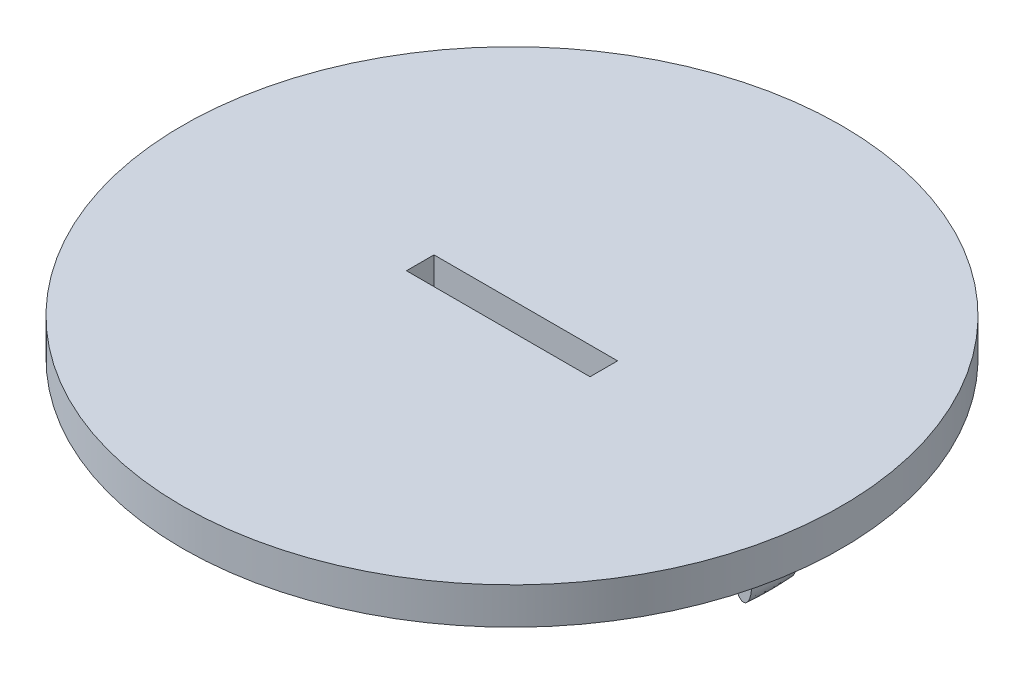
from build123d import *

# Parameters (mm, degrees)
SKETCH_1_R          = 17.95
EXTRUDE_1_DEPTH     = 2
SKETCH_3_R          = 6
EXTRUDE_3_DEPTH     = 1
SKETCH_2_W          = 10
SKETCH_2_H          = 1.5
CUT_EXTRUDE_3_DEPTH = 2
EXTRUDE_1_2_DEPTH   = 1.25
FILLET_6_SIZE       = 1
FILLET_6_SIZE_2     = 2
EXTRUDE_4_DEPTH     = 4
FILLET_3_SIZE       = 1
FILLET_3_SIZE_2     = 0.5
FILLET_4_SIZE       = 1
FILLET_4_SIZE_2     = 0.5
EXTRUDE_5_DEPTH     = 1.4
EXTRUDE_6_DEPTH     = 0.6
FILLET_5_SIZE       = 0.5
FILLET_5_SIZE_2     = 1


# Read off the part's stored shape, not the designer's step: 拉伸-薄壁1
with BuildPart() as part:
    # 草图1 → Extrude 1 (new body)
    with BuildSketch(Plane(origin=(0, 0, 0), x_dir=(1, 0, 0), z_dir=(0, 1, 0))):
        with Locations(Location((0, 0, 0), (0, 0, 270))):
            Circle(SKETCH_1_R)
    extrude(amount=EXTRUDE_1_DEPTH)

    # 草图3 → 凸台-拉伸3 (add)
    with BuildSketch(Plane(origin=(0, 0, 0), x_dir=(1, 0, 0), z_dir=(0, 1, 0))):
        with Locations(Location((0, 0, 0), (0, 0, 270))):
            Circle(SKETCH_3_R)
    extrude(amount=-EXTRUDE_3_DEPTH)

    # 草图2 → 切除-拉伸3 (cut)
    with BuildSketch(Plane(origin=(0, 2, 0), x_dir=(1, 0, 0), z_dir=(0, 1, 0))):
        Rectangle(SKETCH_2_W, SKETCH_2_H)
    extrude(amount=-CUT_EXTRUDE_3_DEPTH, mode=Mode.SUBTRACT)

    # Extrude 1 2 outline → Extrude 1 2 (add)
    with BuildSketch(Plane(origin=(0, -1, 0), x_dir=(-1, 0, 0), z_dir=(0, -1, 0))):
        Polygon((0.375, 0.375), (0.375, 4), (-0.375, 4), (-0.375, 0.375), (-4, 0.375), (-4, -0.375), (-0.375, -0.375), (-0.375, -4), (0.375, -4), (0.375, -0.375), (4, -0.375), (4, 0.375), align=None)
    extrude(amount=EXTRUDE_1_2_DEPTH)

    # 圆角6
    # an asymmetric fillet: 2, 1 mm, written as the material it takes off along each edge
    with BuildSketch(Plane(origin=(5.375, -2.25, 4), x_dir=(0, 1, 0), z_dir=(-1, 0, 0)), Plane(origin=(-4, -2.25, 5.375), x_dir=(0, 1, 0), z_dir=(0, 0, -1)), Plane(origin=(-5.375, -2.25, -4), x_dir=(0, 1, 0), z_dir=(1, 0, 0)), Plane(origin=(4, -2.25, -5.375), x_dir=(0, 1, 0), z_dir=(0, 0, 1))) as fillet_6_piece_1:
        with BuildLine():
            Bezier((FILLET_6_SIZE, 0), (0, 0), (0, FILLET_6_SIZE_2), weights=[1, 0.707106781, 1])
            Line((0, FILLET_6_SIZE_2), (0, 0))
            Line((0, 0), (FILLET_6_SIZE, 0))
        make_face()
    extrude(amount=10.75, mode=Mode.SUBTRACT)

    # 草图6 → 凸台-拉伸4 (add)
    with BuildSketch(Plane(origin=(0, 0, 0), x_dir=(1, 0, 0), z_dir=(0, 1, 0))):
        with BuildLine():
            Line((14.295393918, 1.250684908), (13.29919922, 1.163529166))
            ThreePointArc((13.29919922, 1.163529166), (13.35, 0), (13.29919922, -1.163529166))
            Line((13.29919922, -1.163529166), (14.295393918, -1.250684908))
            ThreePointArc((14.295393918, -1.250684908), (14.35, 0), (14.295393918, 1.250684908))
        make_face()
        with BuildLine():
            Line((-14.295393918, 1.250684908), (-13.29919922, 1.163529166))
            ThreePointArc((-13.29919922, 1.163529166), (-13.35, 0), (-13.29919922, -1.163529166))
            Line((-13.29919922, -1.163529166), (-14.295393918, -1.250684908))
            ThreePointArc((-14.295393918, -1.250684908), (-14.35, 0), (-14.295393918, 1.250684908))
        make_face()
    extrude(amount=-EXTRUDE_4_DEPTH)

    # 圆角3
    # an asymmetric fillet: 1, 0.5 mm, written as the material it takes off along each edge
    with BuildSketch(Plane(origin=(0, -4, 0), x_dir=(0.9660075735561696, 0, 0.25851376720035907), z_dir=(-0.25851376720035907, 0, 0.9660075735561696))) as fillet_3_piece_1:
        with BuildLine():
            Bezier((14.35, FILLET_3_SIZE), (14.35, 0), (14.35 - FILLET_3_SIZE_2, 0), weights=[1, 0.707106781, 1])
            Line((14.35 - FILLET_3_SIZE_2, 0), (14.35, 0))
            Line((14.35, 0), (14.35, FILLET_3_SIZE))
        make_face()
    revolve(axis=Axis((0, -4, 0), (0, 1, 0)), revolution_arc=29.963785221, mode=Mode.SUBTRACT)
    with BuildSketch(Plane(origin=(0, -4, 0), x_dir=(0.962551821417958, 0, -0.27109775189951557), z_dir=(-0.27109775189951557, 0, -0.962551821417958))) as fillet_3_piece_2:
        with BuildLine():
            Bezier((13.35, -FILLET_3_SIZE), (13.35, 0), (13.35 + FILLET_3_SIZE_2, 0), weights=[1, 0.707106781, 1])
            Line((13.35 + FILLET_3_SIZE_2, 0), (13.35, 0))
            Line((13.35, 0), (13.35, -FILLET_3_SIZE))
        make_face()
    revolve(axis=Axis((0, -4, 0), (0, -1, 0)), revolution_arc=31.459199844, mode=Mode.SUBTRACT)

    # 圆角4
    # an asymmetric fillet: 1, 0.5 mm, written as the material it takes off along each edge
    with BuildSketch(Plane(origin=(0, -4, 0), x_dir=(-0.9660075735561696, 0, 0.258513767200359), z_dir=(0.258513767200359, 0, 0.9660075735561696))) as fillet_4_piece_1:
        with BuildLine():
            Bezier((14.35, -FILLET_4_SIZE), (14.35, 0), (14.35 - FILLET_4_SIZE_2, 0), weights=[1, 0.707106781, 1])
            Line((14.35 - FILLET_4_SIZE_2, 0), (14.35, 0))
            Line((14.35, 0), (14.35, -FILLET_4_SIZE))
        make_face()
    revolve(axis=Axis((0, -4, 0), (0, -1, 0)), revolution_arc=29.963785221, mode=Mode.SUBTRACT)
    with BuildSketch(Plane(origin=(0, -4, 0), x_dir=(-0.962551821417958, 0, -0.27109775189951557), z_dir=(0.27109775189951557, 0, -0.962551821417958))) as fillet_4_piece_2:
        with BuildLine():
            Bezier((13.35, FILLET_4_SIZE), (13.35, 0), (13.35 + FILLET_4_SIZE_2, 0), weights=[1, 0.707106781, 1])
            Line((13.35 + FILLET_4_SIZE_2, 0), (13.35, 0))
            Line((13.35, 0), (13.35, FILLET_4_SIZE))
        make_face()
    revolve(axis=Axis((0, -4, 0), (0, 1, 0)), revolution_arc=31.459199844, mode=Mode.SUBTRACT)

    # 草图7 → 凸台-拉伸5 (add)
    with BuildSketch(Plane(origin=(0, 0, 0), x_dir=(1, 0, 0), z_dir=(0, 1, 0))):
        with BuildLine():
            Line((13.549301416, 6.318143013), (12.733624408, 5.937786577))
            ThreePointArc((12.733624408, 5.937786577), (12.167656923, 7.025), (11.509086222, 8.058748931))
            Line((11.509086222, 8.058748931), (12.246323062, 8.574967723))
            ThreePointArc((12.246323062, 8.574967723), (12.947079787, 7.475), (13.549301416, 6.318143013))
        make_face()
        with BuildLine():
            Line((11.452364425, -9.609674765), (10.762924426, -9.031165916))
            ThreePointArc((10.762924426, -9.031165916), (9.934850276, -9.934850276), (9.031165916, -10.762924426))
            Line((9.031165916, -10.762924426), (9.609674765, -11.452364425))
            ThreePointArc((9.609674765, -11.452364425), (10.571246379, -10.571246379), (11.452364425, -9.609674765))
        make_face()
        with BuildLine():
            Line((-9.609674765, 11.452364425), (-9.031165916, 10.762924426))
            ThreePointArc((-9.031165916, 10.762924426), (-9.934850276, 9.934850276), (-10.762924426, 9.031165916))
            Line((-10.762924426, 9.031165916), (-11.452364425, 9.609674765))
            ThreePointArc((-11.452364425, 9.609674765), (-10.571246379, 10.571246379), (-9.609674765, 11.452364425))
        make_face()
        with BuildLine():
            Line((-12.246323062, -8.574967723), (-11.509086222, -8.058748931))
            ThreePointArc((-11.509086222, -8.058748931), (-12.167656923, -7.025), (-12.733624408, -5.937786577))
            Line((-12.733624408, -5.937786577), (-13.549301416, -6.318143013))
            ThreePointArc((-13.549301416, -6.318143013), (-12.947079787, -7.475), (-12.246323062, -8.574967723))
        make_face()
    extrude(amount=-EXTRUDE_5_DEPTH)

    # 草图9 → 凸台-拉伸6 (add)
    with BuildSketch(Plane(origin=(0, -1.4, 0), x_dir=(1, 0, 0), z_dir=(0, 1, 0))):
        with BuildLine():
            Line((12.287280664, 8.603646545), (10.894722189, 7.628566603))
            ThreePointArc((10.894722189, 7.628566603), (11.51813787, 6.65), (12.053893568, 5.620822881))
            Line((12.053893568, 5.620822881), (13.594616806, 6.339273926))
            ThreePointArc((13.594616806, 6.339273926), (12.990381057, 7.5), (12.287280664, 8.603646545))
        make_face()
        with BuildLine():
            Line((11.490666647, -9.641814145), (10.188391093, -8.549075209))
            ThreePointArc((10.188391093, -8.549075209), (9.40452019, -9.40452019), (8.549075209, -10.188391093))
            Line((8.549075209, -10.188391093), (9.641814145, -11.490666647))
            ThreePointArc((9.641814145, -11.490666647), (10.606601718, -10.606601718), (11.490666647, -9.641814145))
        make_face()
        with BuildLine():
            Line((-13.549301416, -6.318143013), (-12.211939408, -5.268637006))
            ThreePointArc((-12.211939408, -5.268637006), (-11.613430564, -6.482147062), (-10.894722189, -7.628566603))
            Line((-10.894722189, -7.628566603), (-12.246323062, -8.574967723))
            ThreePointArc((-12.246323062, -8.574967723), (-12.947079787, -7.475), (-13.549301416, -6.318143013))
        make_face()
        with BuildLine():
            Line((-9.609674765, 11.452364425), (-8.24979505, 10.432204064))
            ThreePointArc((-8.24979505, 10.432204064), (-9.267050266, 9.540009401), (-10.188391093, 8.549075209))
            Line((-10.188391093, 8.549075209), (-11.452364425, 9.609674765))
            ThreePointArc((-11.452364425, 9.609674765), (-10.571246379, 10.571246379), (-9.609674765, 11.452364425))
        make_face()
    extrude(amount=-EXTRUDE_6_DEPTH)

    # 圆角5
    # an asymmetric fillet: 1, 0.5 mm, written as the material it takes off along each edge
    with BuildSketch(Plane(origin=(0, -2, 0), x_dir=(-0.976042170685715, 0, 0.21758143542847977), z_dir=(-0.21758143542847977, 0, -0.976042170685715))) as fillet_5_piece_1:
        with BuildLine():
            Bezier((13.3, FILLET_5_SIZE), (13.3, 0), (13.3 + FILLET_5_SIZE_2, 0), weights=[1, 0.707106781, 1])
            Line((13.3 + FILLET_5_SIZE_2, 0), (13.3, 0))
            Line((13.3, 0), (13.3, FILLET_5_SIZE))
        make_face()
    revolve(axis=Axis((0, -2, 0), (0, 1, 0)), revolution_arc=33.20293734, mode=Mode.SUBTRACT)
    with BuildSketch(Plane(origin=(0, -2, 0), x_dir=(-0.46278583039806825, 0, -0.8864701208629485), z_dir=(0.8864701208629485, 0, -0.46278583039806825))) as fillet_5_piece_2:
        with BuildLine():
            Bezier((13.3, FILLET_5_SIZE), (13.3, 0), (13.3 + FILLET_5_SIZE_2, 0), weights=[1, 0.707106781, 1])
            Line((13.3 + FILLET_5_SIZE_2, 0), (13.3, 0))
            Line((13.3, 0), (13.3, FILLET_5_SIZE))
        make_face()
    revolve(axis=Axis((0, -2, 0), (0, 1, 0)), revolution_arc=33.20293734, mode=Mode.SUBTRACT)
    with BuildSketch(Plane(origin=(0, -2, 0), x_dir=(0.872665975959087, 0, 0.48831761631480614), z_dir=(0.48831761631480614, 0, -0.872665975959087))) as fillet_5_piece_3:
        with BuildLine():
            Bezier((13.3, -FILLET_5_SIZE), (13.3, 0), (13.3 + FILLET_5_SIZE_2, 0), weights=[1, 0.707106781, 1])
            Line((13.3 + FILLET_5_SIZE_2, 0), (13.3, 0))
            Line((13.3, 0), (13.3, -FILLET_5_SIZE))
        make_face()
    revolve(axis=Axis((0, -2, 0), (0, -1, 0)), revolution_arc=31.539873528, mode=Mode.SUBTRACT)
    with BuildSketch(Plane(origin=(0, -2, 0), x_dir=(0.6975411716215796, 0, -0.7165447047412982), z_dir=(-0.7165447047412982, 0, -0.6975411716215796))) as fillet_5_piece_4:
        with BuildLine():
            Bezier((13.3 + FILLET_5_SIZE_2, 0), (13.3, 0), (13.3, -FILLET_5_SIZE), weights=[1, 0.707106781, 1])
            Line((13.3, -FILLET_5_SIZE), (13.3, 0))
            Line((13.3, 0), (13.3 + FILLET_5_SIZE_2, 0))
        make_face()
    revolve(axis=Axis((0, -2, 0), (0, -1, 0)), revolution_arc=31.539873528, mode=Mode.SUBTRACT)


solid = part.part
